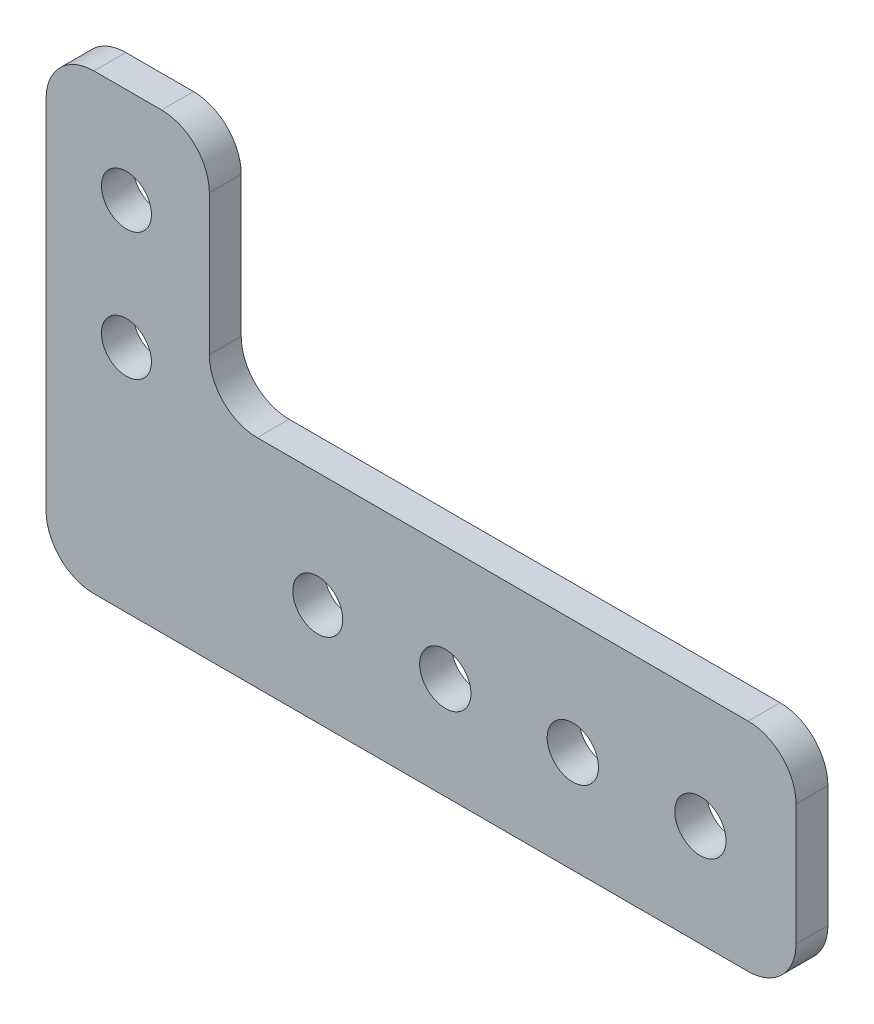
from build123d import *

# Parameters (mm, degrees)
SKETCH1_R           = 2.4892
SKETCH1_R_2         = 2.5527
BOSS_EXTRUDE1_DEPTH = 3.175
FILLET1_R           = 4.7625


with BuildPart() as part:
    # Sketch1 → Boss-Extrude1 (new body)
    with BuildSketch(Plane.XY):
        Polygon((-33.401, 23.8125), (-33.401, -21.2725), (41.275, -21.2725), (41.275, 0.3175), (-17.145, 0.3175), (-17.145, 23.8125), align=None)
        with Locations((-6.35, -11.1125)):
            Circle(SKETCH1_R, mode=Mode.SUBTRACT)
        with Locations((6.35, -11.1125)):
            Circle(SKETCH1_R_2, mode=Mode.SUBTRACT)
        with Locations((19.05, -11.1125)):
            Circle(SKETCH1_R_2, mode=Mode.SUBTRACT)
        with Locations((31.75, -11.1125)):
            Circle(SKETCH1_R_2, mode=Mode.SUBTRACT)
        with Locations((-25.4, 1.5875)):
            Circle(SKETCH1_R, mode=Mode.SUBTRACT)
        with Locations((-25.4, 14.2875)):
            Circle(SKETCH1_R, mode=Mode.SUBTRACT)
    extrude(amount=BOSS_EXTRUDE1_DEPTH)

    # Fillet1
    fillet1_edges = [part.edges().sort_by_distance(p)[0] for p in [
        (-33.401, 23.8125, 1.5875),
        (-17.145, 23.8125, 1.5875),
        (-17.145, 0.3175, 1.5875),
        (41.275, 0.3175, 1.5875),
        (41.275, -21.2725, 1.5875),
        (-33.401, -21.2725, 1.5875),
    ]]
    fillet(fillet1_edges, radius=FILLET1_R)


solid = part.part
